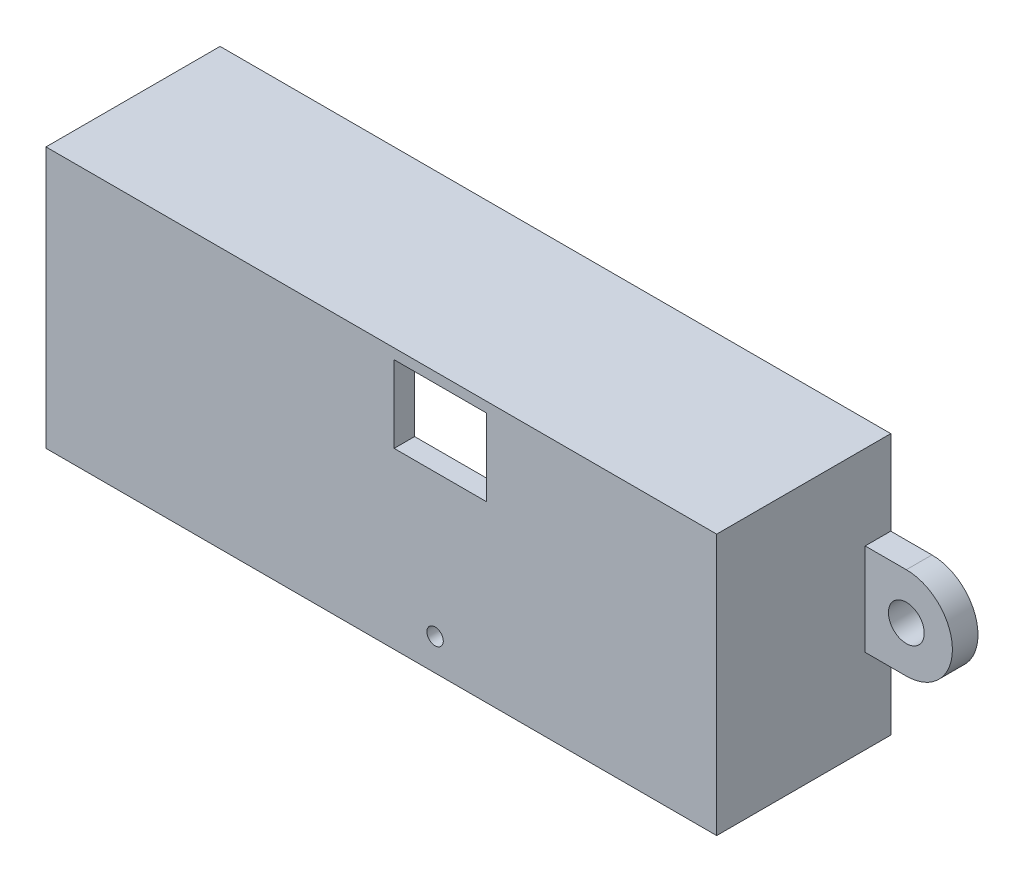
from build123d import *

# Parameters (mm, degrees)
SKETCH_1_W           = 123
SKETCH_1_H           = 43
EXTRUDE_1_DEPTH      = 4
EXTRUDE_2_DEPTH      = 30
EXTRUDE_2_DEPTH_BACK = 4
SKETCH_2_W           = 131
SKETCH_2_H           = 51
SKETCH_2_W_2         = 123
SKETCH_2_H_2         = 43
SKETCH_3_R           = 3.5
EXTRUDE_3_DEPTH      = 5
SKETCH_5_R           = 1.6
SKETCH_5_W           = 18
SKETCH_5_H           = 15
CUT_EXTRUDE_1_DEPTH  = 10
CUT_EXTRUDE_2_DEPTH  = 10


with BuildPart() as part:
    # Эскиз1 → Бобышка-Вытянуть1 (new body)
    with BuildSketch(Plane.XY):
        with Locations((61.5, 21.5)):
            Rectangle(SKETCH_1_W, SKETCH_1_H)
    extrude(amount=EXTRUDE_1_DEPTH)

    # Эскиз2 → Бобышка-Вытянуть2 (add, two sides: drawn at the far end of the back side and taken through both)
    with BuildSketch(Plane(origin=(0, 0, 0), x_dir=(-1, 0, 0), z_dir=(0, 0, -1)).offset(-EXTRUDE_2_DEPTH_BACK)):
        with Locations((-61.5, 21.5)):
            Rectangle(SKETCH_2_W, SKETCH_2_H)
        with Locations((-61.5, 21.5)):
            Rectangle(SKETCH_2_W_2, SKETCH_2_H_2, mode=Mode.SUBTRACT)
    extrude(amount=EXTRUDE_2_DEPTH + EXTRUDE_2_DEPTH_BACK)

    # Эскиз3 → Бобышка-Вытянуть3 (add)
    with BuildSketch(Plane(origin=(0, 0, -30), x_dir=(-1, 0, 0), z_dir=(0, 0, -1))):
        with BuildLine():
            Line((-127, 12.5), (-135.04002612, 12.5))
            ThreePointArc((-135.04002612, 12.5), (-144.04002612, 21.5), (-135.04002612, 30.5))
            Line((-135.04002612, 30.5), (-127, 30.5))
            Line((-127, 30.5), (-127, 12.5))
        make_face()
        with Locations((-135.04002612, 21.5)):
            Circle(SKETCH_3_R, mode=Mode.SUBTRACT)
    extrude_3 = extrude(amount=-EXTRUDE_3_DEPTH)

    # Зеркальное отражение1: Бобышка-Вытянуть3 across plane
    add(extrude_3.mirror(Plane(origin=(61.5, 0, 0), x_dir=(0, 0, 1), z_dir=(1, 0, 0))))

    # Эскиз5 → Вырез-Вытянуть1 (cut)
    with BuildSketch(Plane.XY.offset(4)):
        with Locations((72, 2.2)):
            Circle(SKETCH_5_R)
        with Locations((73, 37.5)):
            Rectangle(SKETCH_5_W, SKETCH_5_H)
    extrude(amount=-CUT_EXTRUDE_1_DEPTH, mode=Mode.SUBTRACT)

    # Эскиз6 → Вырез-Вытянуть2 (cut)
    with BuildSketch(Plane.ZY.offset(4)):
        Polygon((-20, 17.3), (-22.5, 17.3), (-22.5, 16.65), (-24.5, 16.65), (-24.5, 9.65), (-22.5, 9.65), (-22.5, 9), (-20, 9), align=None)
    extrude(amount=-CUT_EXTRUDE_2_DEPTH, mode=Mode.SUBTRACT)


solid = part.part
